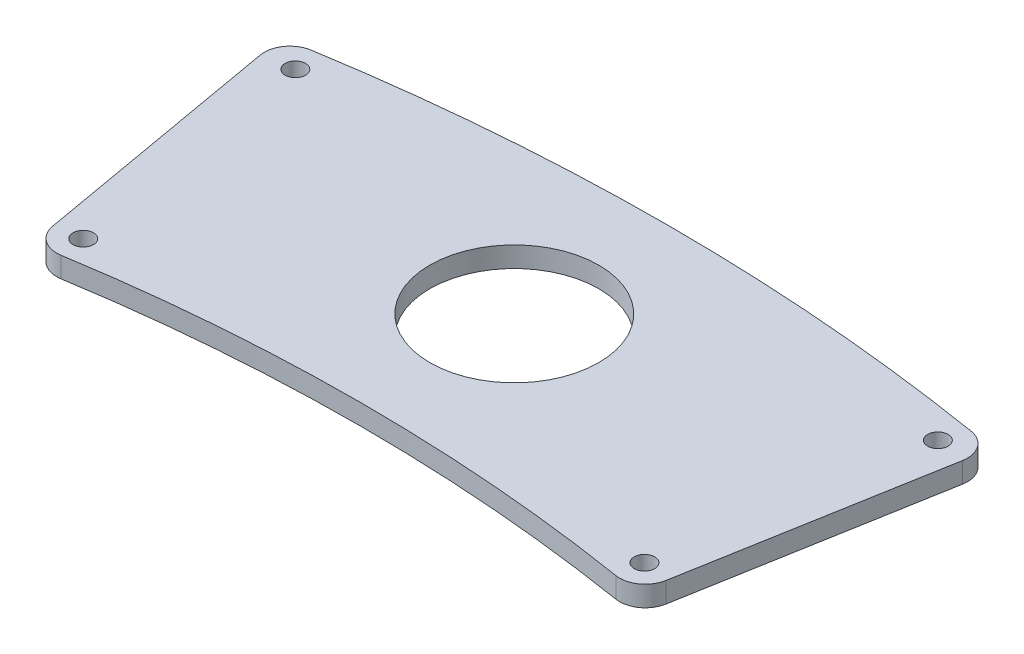
from build123d import *

# Parameters (mm, degrees)
SKETCH_1_R             = 16.5
SM_BASE_FLANGE_1_DEPTH = 4
SKETCH_4_R             = 2
CUT_EXTRUDE_1_DEPTH    = 10
FILLET_3_R             = 5


# Sheet-metal steps are written as plain solids
with BuildPart() as part:
    # Sketch 1 → Базовая кромка1 (new body)
    with BuildSketch(Plane(origin=(0, 0, 0), x_dir=(1, 0, 0), z_dir=(0, 1, 0))):
        with BuildLine():
            Line((-59.040380407, 334.834636024), (-69.459271067, 393.923101205))
            ThreePointArc((-69.459271067, 393.923101205), (0, 400), (69.459271067, 393.923101205))
            Line((69.459271067, 393.923101205), (59.040380407, 334.834636024))
            ThreePointArc((59.040380407, 334.834636024), (0, 340), (-59.040380407, 334.834636024))
        make_face()
        with Locations(Location((0, 370, 0), (0, 0, 270))):
            Circle(SKETCH_1_R, mode=Mode.SUBTRACT)
    extrude(amount=-SM_BASE_FLANGE_1_DEPTH)

    # Эскиз4 → Вырез-Вытянуть1 (cut)
    with BuildSketch(Plane(origin=(0, 0, 0), x_dir=(1, 0, 0), z_dir=(0, 1, 0))):
        with Locations(Location((62.748327317, 389.984163036, 0), (0, 0, 270))):
            Circle(SKETCH_4_R)
        with Locations(Location((54.805501074, 340.619079107, 0), (0, 0, 270))):
            Circle(SKETCH_4_R)
        with Locations(Location((-54.805501074, 340.619079107, 0), (0, 0, 270))):
            Circle(SKETCH_4_R)
        with Locations(Location((-62.748327317, 389.984163036, 0), (0, 0, 270))):
            Circle(SKETCH_4_R)
    extrude(amount=-CUT_EXTRUDE_1_DEPTH, mode=Mode.SUBTRACT)

    # Скругление3
    fillet_3_edges = [part.edges().sort_by_distance(p)[0] for p in [
        (-59.040380407, -2, -334.834636024),
        (-69.459271067, -2, -393.923101205),
        (69.459271067, -2, -393.923101205),
        (59.040380407, -2, -334.834636024),
    ]]
    fillet(fillet_3_edges, radius=FILLET_3_R)


solid = part.part
